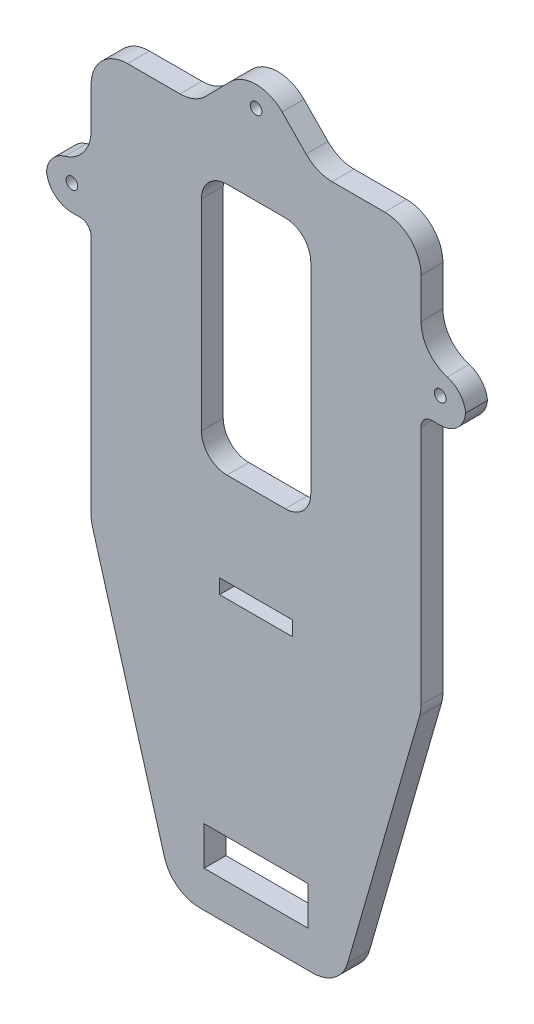
from build123d import *

# Parameters (mm, degrees)
ESBO_O1_R                = 1.6
ESBO_O1_W                = 28.5
ESBO_O1_H                = 10.6
ESBO_O1_W_2              = 30
ESBO_O1_H_2              = 69.1
ESBO_O1_W_3              = 20
ESBO_O1_H_3              = 4
RESSALTO_EXTRUS_O1_DEPTH = 6
FILETE3_R                = 3
FILETE4_R                = 10
FILETE5_R                = 7


with BuildPart() as part:
    # Esboço1 → Ressalto-extrusão1 (new body)
    with BuildSketch(Plane.XY):
        Polygon((-45.25, -56.75), (-23.05952475, -133.85), (23.05952475, -133.85), (45.25, -56.75), (45.25, 13.75), (57.5, 13.75), (57.5, 25.75), (45.25, 25.75), (45.25, 56.75), (16.663333, 56.75), (0, 73.75), (-16.663333, 56.75), (-45.25, 56.75), (-45.25, 25.75), (-57.5, 25.75), (-57.5, 13.75), (-45.25, 13.75), align=None)
        with Locations((0, 63.75)):
            Circle(ESBO_O1_R, mode=Mode.SUBTRACT)
        with Locations((-50.5, 20.75)):
            Circle(ESBO_O1_R, mode=Mode.SUBTRACT)
        with Locations((50.5, 20.75)):
            Circle(ESBO_O1_R, mode=Mode.SUBTRACT)
        with Locations((0, -118.55)):
            Rectangle(ESBO_O1_W, ESBO_O1_H, mode=Mode.SUBTRACT)
        with Locations((0, 7.2)):
            Rectangle(ESBO_O1_W_2, ESBO_O1_H_2, mode=Mode.SUBTRACT)
        with Locations((0, -54.75)):
            Rectangle(ESBO_O1_W_3, ESBO_O1_H_3, mode=Mode.SUBTRACT)
    extrude(amount=RESSALTO_EXTRUS_O1_DEPTH)

    # Filete3
    filete3_edges = [part.edges().sort_by_distance(p)[0] for p in [
        (-45.25, 13.75, 3),
        (45.25, 13.75, 3),
    ]]
    fillet(filete3_edges, radius=FILETE3_R)

    # Filete4
    filete4_edges = [part.edges().sort_by_distance(p)[0] for p in [
        (-45.25, 25.75, 3),
        (-45.25, 56.75, 3),
        (-16.663333, 56.75, 3),
        (0, 73.75, 3),
        (16.663333, 56.75, 3),
        (45.25, 56.75, 3),
        (45.25, 25.75, 3),
        (45.25, -56.75, 3),
        (23.05952475, -133.85, 3),
        (-23.05952475, -133.85, 3),
        (-45.25, -56.75, 3),
    ]]
    fillet(filete4_edges, radius=FILETE4_R)

    # Filete5
    # the kernel refuses this fillet: 7 mm, written as the material it adds along each edge
    with BuildSketch(Plane(origin=(-15, -27.35, 0), x_dir=(1, 0, 0), z_dir=(0, 0, 1)), Plane(origin=(15, 41.75, 0), x_dir=(-1, 0, 0), z_dir=(0, 0, 1)), Plane(origin=(-15, 41.75, 0), x_dir=(0, -1, 0), z_dir=(0, 0, 1))) as filete5_piece_1:
        with BuildLine():
            CenterArc((FILETE5_R, FILETE5_R), FILETE5_R, 180, 90)
            Line((0, FILETE5_R), (0, 0))
            Line((0, 0), (FILETE5_R, 0))
        make_face()
    extrude(amount=6)
    with BuildSketch(Plane(origin=(15, -27.35, 0), x_dir=(-1, 0, 0), z_dir=(0, 0, 1))) as filete5_piece_2:
        with BuildLine():
            CenterArc((FILETE5_R, -FILETE5_R), FILETE5_R, 90, 90)
            Line((0, -FILETE5_R), (0, 0))
            Line((0, 0), (FILETE5_R, 0))
        make_face()
    extrude(amount=6)
    # the kernel refuses this fillet: 7 mm, written as the material it takes off along each edge
    with BuildSketch(Plane(origin=(57.5, 13.75, -17.5), x_dir=(-1, 0, 0), z_dir=(0, 0, 1))) as filete5_2_piece_1:
        with BuildLine():
            CenterArc((FILETE5_R, -FILETE5_R), FILETE5_R, 90, 90)
            Line((0, -FILETE5_R), (0, 0))
            Line((0, 0), (FILETE5_R, 0))
        make_face()
    extrude(amount=41, mode=Mode.SUBTRACT)
    with BuildSketch(Plane(origin=(57.5, 25.75, -15.807283357), x_dir=(0, -1, 0), z_dir=(0, 0, 1))) as filete5_2_piece_2:
        with BuildLine():
            CenterArc((6.322913343, -7), FILETE5_R, 90, 73.774899865)
            Line((-0.398286269, -5.044117647), (-1.07040623, -4.848529412))
            ThreePointArc((-1.07040623, -4.848529412), (-0.7, -2.25), (-0.7, 0))
            Line((-0.7, 0), (0, 0.7))
            Line((0, 0.7), (6.322913343, 0.7))
            Line((6.322913343, 0.7), (6.322913343, 0))
        make_face()
    extrude(amount=37.614566715, mode=Mode.SUBTRACT)
    with BuildSketch(Plane(origin=(-57.5, 13.75, -17.5), x_dir=(1, 0, 0), z_dir=(0, 0, 1))) as filete5_2_piece_3:
        with BuildLine():
            CenterArc((FILETE5_R, FILETE5_R), FILETE5_R, 180, 90)
            Line((0, FILETE5_R), (0, 0))
            Line((0, 0), (FILETE5_R, 0))
        make_face()
    extrude(amount=41, mode=Mode.SUBTRACT)
    with BuildSketch(Plane(origin=(-57.5, 25.75, -15.807283357), x_dir=(0, -1, 0), z_dir=(0, 0, 1))) as filete5_2_piece_4:
        with BuildLine():
            CenterArc((6.322913343, 7), FILETE5_R, 196.225100135, 73.774899865)
            Line((-0.398286269, 5.044117647), (-1.07040623, 4.848529412))
            ThreePointArc((-1.07040623, 4.848529412), (-0.7, 2.25), (-0.7, 0))
            Line((-0.7, 0), (0, -0.7))
            Line((0, -0.7), (6.322913343, -0.7))
            Line((6.322913343, -0.7), (6.322913343, 0))
        make_face()
    extrude(amount=37.614566715, mode=Mode.SUBTRACT)


solid = part.part
